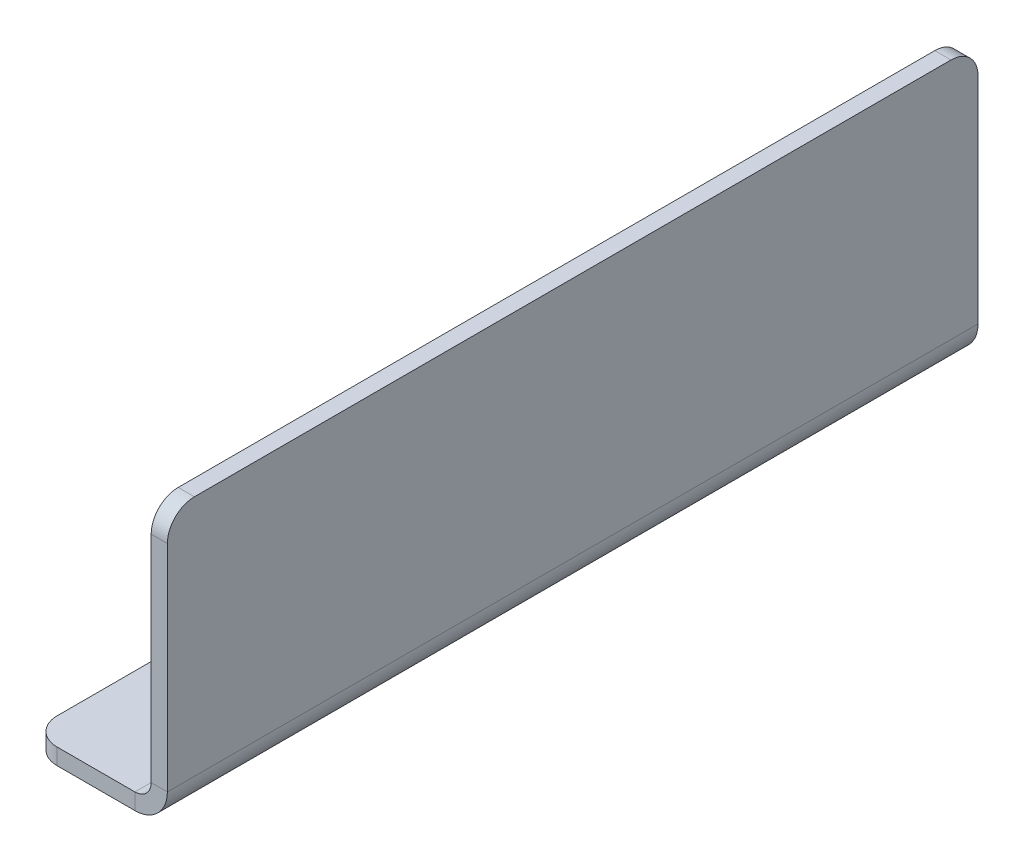
from build123d import *

# Parameters (mm, degrees)
BASE_FLANGE1_DEPTH           = 150
F_30_0_1285_DIAMETER_HOLE1_D = 3.2639
FILLET1_R                    = 5


# Sheet-metal steps are written as plain solids
with BuildPart() as part:
    # Sketch1 → Base-Flange1 (new body)
    with BuildSketch(Plane.XY):
        with BuildLine():
            Line((-25.4, 0), (-6, 0))
            ThreePointArc((-6, 0), (-1.757359313, 1.757359313), (0, 6))
            Line((0, 6), (0, 50.8))
            Line((0, 50.8), (-3, 50.8))
            Line((-3, 50.8), (-3, 6))
            ThreePointArc((-3, 6), (-3.878679656, 3.878679656), (-6, 3))
            Line((-6, 3), (-25.4, 3))
            Line((-25.4, 3), (-25.4, 0))
        make_face()
    extrude(amount=BASE_FLANGE1_DEPTH)

    # #30 (0.1285) Diameter Hole1 (through all)
    with Locations(Plane(origin=(0, 3, 0), x_dir=(1, 0, 0), z_dir=(0, 1, 0))):
        with Locations((-15.7, -25), (-15.7, -75), (-15.7, -125)):
            Hole(F_30_0_1285_DIAMETER_HOLE1_D / 2)

    # Fillet1
    fillet1_edges = [part.edges().sort_by_distance(p)[0] for p in [
        (-1.5, 50.8, 150),
        (-1.5, 50.8, 0),
        (-25.4, 1.5, 150),
        (-25.4, 1.5, 0),
    ]]
    fillet(fillet1_edges, radius=FILLET1_R)


solid = part.part
